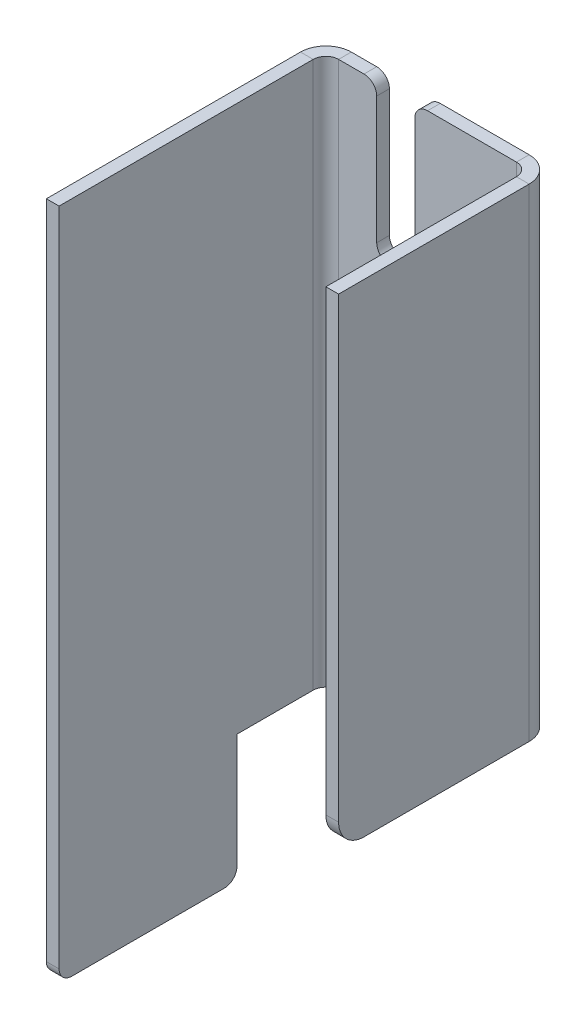
from build123d import *

# Parameters (mm, degrees)
SM_BASE_FLANGE_1_DEPTH   = 43
SKETCH_6_W               = 14
SKETCH_6_H               = 10
SM_BASE_FLANGE_1_2_DEPTH = 1
SKETCH_9_W               = 3
SKETCH_9_H               = 12
CUT_EXTRUDE_1_DEPTH      = 10
CUT_EXTRUDE_2_DEPTH      = 12
FILLET_1_R               = 1


# Sheet-metal steps are written as plain solids
with BuildPart() as part:
    # Sketch 1 → Sm Base Flange 1 (new body)
    with BuildSketch(Plane(origin=(0, 0, 0), x_dir=(1, 0, 0), z_dir=(0, 1, 0))):
        with BuildLine():
            Line((0, 0), (0, 20))
            ThreePointArc((0, 20), (0.585786438, 21.414213562), (2, 22))
            Line((2, 22), (16, 22))
            ThreePointArc((16, 22), (17.414213562, 21.414213562), (18, 20))
            Line((18, 20), (18, 0))
            Line((18, 0), (17, 0))
            Line((17, 0), (17, 20))
            ThreePointArc((17, 20), (16.707106781, 20.707106781), (16, 21))
            Line((16, 21), (2, 21))
            ThreePointArc((2, 21), (1.292893219, 20.707106781), (1, 20))
            Line((1, 20), (1, 0))
            Line((1, 0), (0, 0))
        make_face()
    extrude(amount=SM_BASE_FLANGE_1_DEPTH)

    # Эскиз6 → Sm Base Flange 1 2 (add)
    with BuildSketch(Plane.ZY):
        with Locations((-7, -5)):
            Rectangle(SKETCH_6_W, SKETCH_6_H)
    extrude(amount=-SM_BASE_FLANGE_1_2_DEPTH)

    # Эскиз9 → Вырез-Вытянуть1 (cut)
    with BuildSketch(Plane(origin=(0, 0, -22), x_dir=(-1, 0, 0), z_dir=(0, 0, -1))):
        with Locations((-6.5, 37)):
            Rectangle(SKETCH_9_W, SKETCH_9_H)
    extrude(amount=-CUT_EXTRUDE_1_DEPTH, mode=Mode.SUBTRACT)

    # Эскиз10 → Вырез-Вытянуть2 (cut)
    with BuildSketch(Plane(origin=(18, 0, 0), x_dir=(0, 0, -1), z_dir=(1, 0, 0))):
        with BuildLine():
            Line((0, 43), (5, 43))
            Line((5, 43), (5, 7))
            ThreePointArc((5, 7), (5.585786438, 5.585786438), (7, 5))
            Line((7, 5), (22, 5))
            Line((22, 5), (22, 0))
            Line((22, 0), (0, 0))
            Line((0, 0), (0, 43))
        make_face()
    extrude(amount=-CUT_EXTRUDE_2_DEPTH, mode=Mode.SUBTRACT)

    # Скругление1
    fillet_1_edges = [part.edges().sort_by_distance(p)[0] for p in [
        (6, 0, -21.5),
        (6, 5, -21.5),
        (0.5, -10, 0),
        (0.5, -10, -14),
        (5, 43, -21.5),
        (5, 31, -21.5),
        (8, 31, -21.5),
        (8, 43, -21.5),
    ]]
    fillet(fillet_1_edges, radius=FILLET_1_R)


solid = part.part
